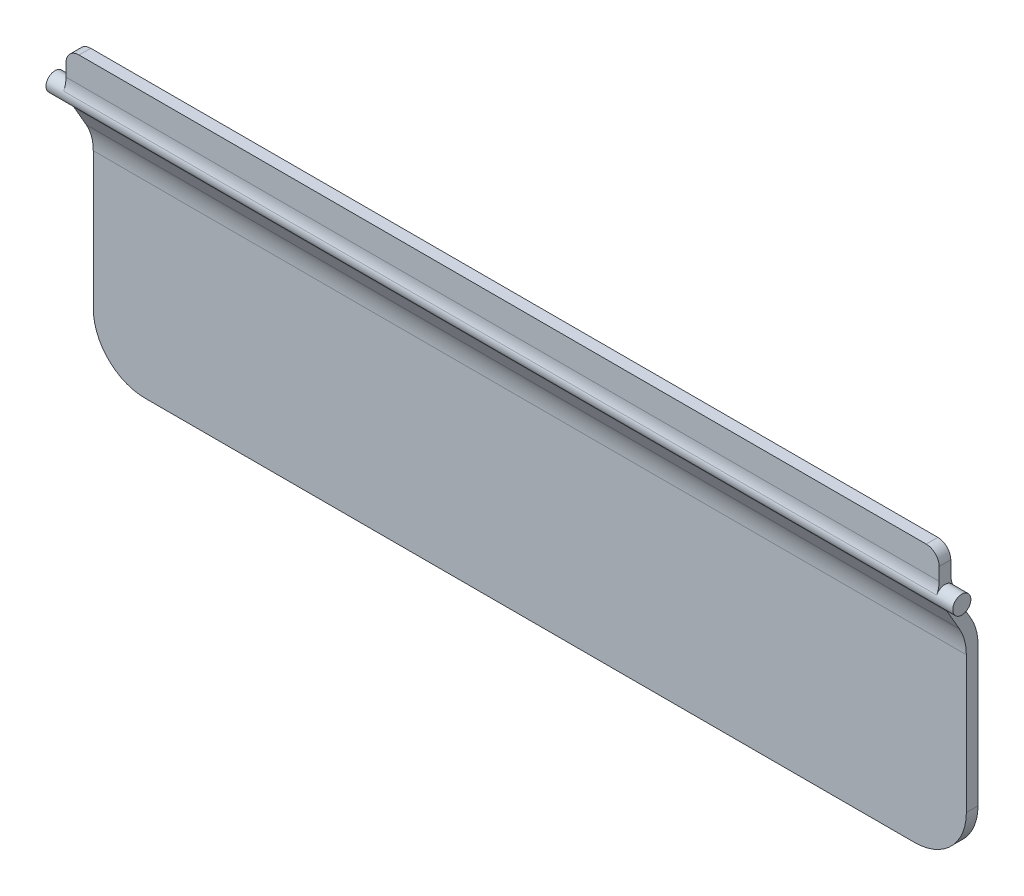
from build123d import *

# Parameters (mm, degrees)
BOSS_EXTRUDE1_DEPTH = 168.5
SKETCH2_R           = 3.5
BOSS_EXTRUDE2_DEPTH = 175
FILLET1_R           = 20
SKETCH3_W           = 337
SKETCH3_H           = 35
CUT_EXTRUDE1_DEPTH  = 191.195458673
FILLET2_R           = 10
FILLET3_R           = 5


with BuildPart() as part:
    # Sketch1 → Boss-Extrude1 (new, symmetric)
    with BuildSketch(Plane(origin=(0, 0, 0), x_dir=(0, 0, -1), z_dir=(1, 0, 0))):
        Polygon((-7.5, 73.75), (-7.5, 22.544228634), (3, 4.357695155), (3, -73.75), (7.5, -73.75), (7.5, 5.563466521), (-3, 23.75), (-3, 73.75), align=None)
    extrude(amount=BOSS_EXTRUDE1_DEPTH, both=True)

    # Sketch2 → Boss-Extrude2 (add, symmetric)
    with BuildSketch(Plane(origin=(0, 0, 0), x_dir=(0, 0, -1), z_dir=(1, 0, 0))):
        with Locations((-5.25, 23.147114317)):
            Circle(SKETCH2_R)
    extrude(amount=BOSS_EXTRUDE2_DEPTH, both=True)

    # Fillet1
    fillet1_edges = [part.edges().sort_by_distance(p)[0] for p in [
        (-168.5, 73.75, 5.25),
        (0, 5.563466521, -7.5),
        (0, 4.357695155, -3),
        (168.5, -73.75, -5.25),
        (168.5, 73.75, 5.25),
        (-168.5, -73.75, -5.25),
    ]]
    fillet(fillet1_edges, radius=FILLET1_R)

    # Sketch3 → Cut-Extrude1 (cut, through all)
    with BuildSketch(Plane(origin=(0, 0, 3), x_dir=(-1, 0, 0), z_dir=(0, 0, -1))):
        with Locations((0, 56.25)):
            Rectangle(SKETCH3_W, SKETCH3_H)
    extrude(amount=-CUT_EXTRUDE1_DEPTH, mode=Mode.SUBTRACT)

    # Fillet2
    # the kernel refuses this fillet: 10 mm, written as the material it adds along each edge
    with BuildSketch(Plane(origin=(-168.5, 21.950342364, 1.96096718), x_dir=(0, 0.9916201681580873, -0.12918762364145653), z_dir=(1, 0, 0))) as fillet2_piece_1:
        with BuildLine():
            CenterArc((3.700369944, -9.760226866), FILLET2_R, 102.572148387, 24.85050234)
            Line((-2.376528536, -1.818482419), (0, 0))
            ThreePointArc((0, 0), (0.761840871, -0.083920597), (1.523681742, 0))
        make_face()
    extrude(amount=337)
    with BuildSketch(Plane(origin=(-168.5, 19.700342364, 5.858081497), x_dir=(0, 0.38393032015099443, 0.9233620683506307), z_dir=(1, 0, 0)), Plane(origin=(-168.5, 25.828065641, 3), x_dir=(0, -0.7941744447091721, -0.6076898480070884), z_dir=(1, 0, 0))) as fillet2_piece_2:
        with BuildLine():
            CenterArc((3.700369944, 9.760226866), FILLET2_R, 232.577349272, 24.85050234)
            Line((-2.376528536, 1.818482419), (0, 0))
            ThreePointArc((0, 0), (0.761840871, 0.083920597), (1.523681742, 0))
        make_face()
    extrude(amount=337)
    with BuildSketch(Plane(origin=(-168.5, 25.828065641, 7.5), x_dir=(0, 1, 0), z_dir=(1, 0, 0))) as fillet2_piece_3:
        with BuildLine():
            CenterArc((2.992451535, 10), FILLET2_R, 245.14949766, 24.85050234)
            ThreePointArc((-1.210069101, 0.925925926), (-0.554036856, 0.529610556), (0, 0))
            Line((0, 0), (2.992451535, 0))
        make_face()
    extrude(amount=337)

    # Fillet3
    fillet3_edges = [part.edges().sort_by_distance(p)[0] for p in [
        (-168.5, 38.75, 5.25),
        (168.5, 38.75, 5.25),
    ]]
    fillet(fillet3_edges, radius=FILLET3_R)


solid = part.part
